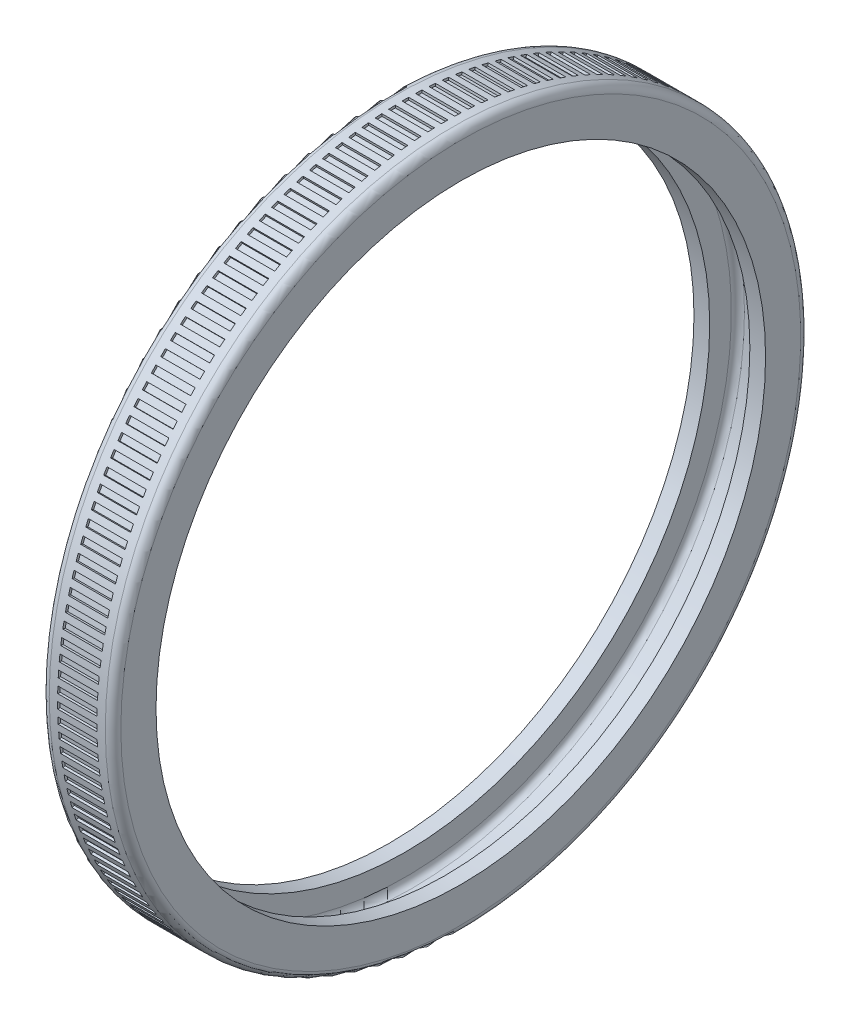
from build123d import *

# Parameters (mm, degrees)
SKETCH2_W          = 0.8
SKETCH2_H          = 2
CUT_EXTRUDE1_DEPTH = 2.4
CIRPATTERN1_COUNT  = 163


with BuildPart() as part:
    # Sketch1 → Revolve1 (revolve)
    with BuildSketch(Plane.XY, mode=Mode.PRIVATE) as revolve1_sk:
        with BuildLine():
            Line((-4.375, 37.25), (-4.375, 41.55))
            ThreePointArc((-4.375, 41.55), (-4.096751442, 42.221751442), (-3.425, 42.5))
            Line((-3.425, 42.5), (3.425, 42.5))
            ThreePointArc((3.425, 42.5), (4.096751442, 42.221751442), (4.375, 41.55))
            Line((4.375, 41.55), (4.375, 37.25))
            Line((4.375, 37.25), (2.454347753, 37.25))
            Line((2.454347753, 37.25), (2.454347753, 39.9))
            ThreePointArc((2.454347753, 39.9), (2.220033178, 40.465685425), (1.654347753, 40.7))
            Line((1.654347753, 40.7), (-1.654347753, 40.7))
            ThreePointArc((-1.654347753, 40.7), (-2.220033178, 40.465685425), (-2.454347753, 39.9))
            Line((-2.454347753, 39.9), (-2.454347753, 37.25))
            Line((-2.454347753, 37.25), (-4.375, 37.25))
        make_face()
    revolve(revolve1_sk.sketch.rotate(Axis((-1000, 0, 0), (1, 0, 0)), 90), axis=Axis((-1000, 0, 0), (1, 0, 0)))

    # Sketch2 → Cut-Extrude1 (cut, symmetric)
    with BuildSketch(Plane(origin=(0, 0, 0), x_dir=(0, 0, -1), z_dir=(1, 0, 0))):
        with Locations((0, 43.2)):
            Rectangle(SKETCH2_W, SKETCH2_H)
    cut_extrude1 = extrude(amount=CUT_EXTRUDE1_DEPTH, both=True, mode=Mode.SUBTRACT)

    # CirPattern1: Cut-Extrude1 ×163 about axis
    cirpattern1_axis = Axis((0, 0, 0), (1, 0, 0))
    for i in range(1, CIRPATTERN1_COUNT):
        add(cut_extrude1.rotate(cirpattern1_axis, i * 360 / CIRPATTERN1_COUNT), mode=Mode.SUBTRACT)


solid = part.part
